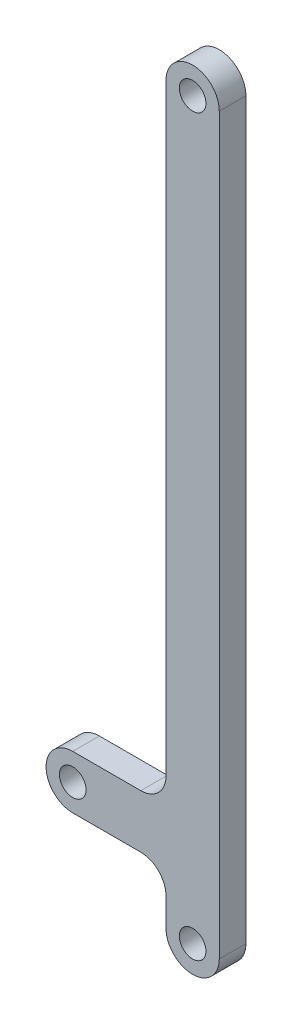
from build123d import *

# Parameters (mm, degrees)
SKETCH1_R           = 6.35
BOSS_EXTRUDE3_DEPTH = 12.7


with BuildPart() as part:
    # Sketch1 → Boss-Extrude3 (new body)
    with BuildSketch(Plane.XY):
        with BuildLine():
            Line((-47.542004278, -98.882477908), (-47.542004278, -112.270477908))
            ThreePointArc((-47.542004278, -112.270477908), (-34.842004278, -124.970477908), (-22.142004278, -112.270477908))
            Line((-22.142004278, -112.270477908), (-22.142004278, 237.729522092))
            ThreePointArc((-22.142004278, 237.729522092), (-34.842004278, 250.429522092), (-47.542004278, 237.729522092))
            Line((-47.542004278, 237.729522092), (-47.542004278, -49.482477908))
            ThreePointArc((-47.542004278, -49.482477908), (-51.056722903, -57.967759282), (-59.542004278, -61.482477908))
            Line((-59.542004278, -61.482477908), (-91.992004278, -61.482477908))
            ThreePointArc((-91.992004278, -61.482477908), (-104.692004278, -74.182477908), (-91.992004278, -86.882477908))
            Line((-91.992004278, -86.882477908), (-59.542004278, -86.882477908))
            ThreePointArc((-59.542004278, -86.882477908), (-51.056722903, -90.397196534), (-47.542004278, -98.882477908))
        make_face()
        with Locations((-34.842004278, 237.729522092)):
            Circle(SKETCH1_R, mode=Mode.SUBTRACT)
        with Locations((-91.992004278, -74.182477908)):
            Circle(SKETCH1_R, mode=Mode.SUBTRACT)
        with Locations((-34.842004278, -112.270477908)):
            Circle(SKETCH1_R, mode=Mode.SUBTRACT)
    extrude(amount=BOSS_EXTRUDE3_DEPTH)


solid = part.part
